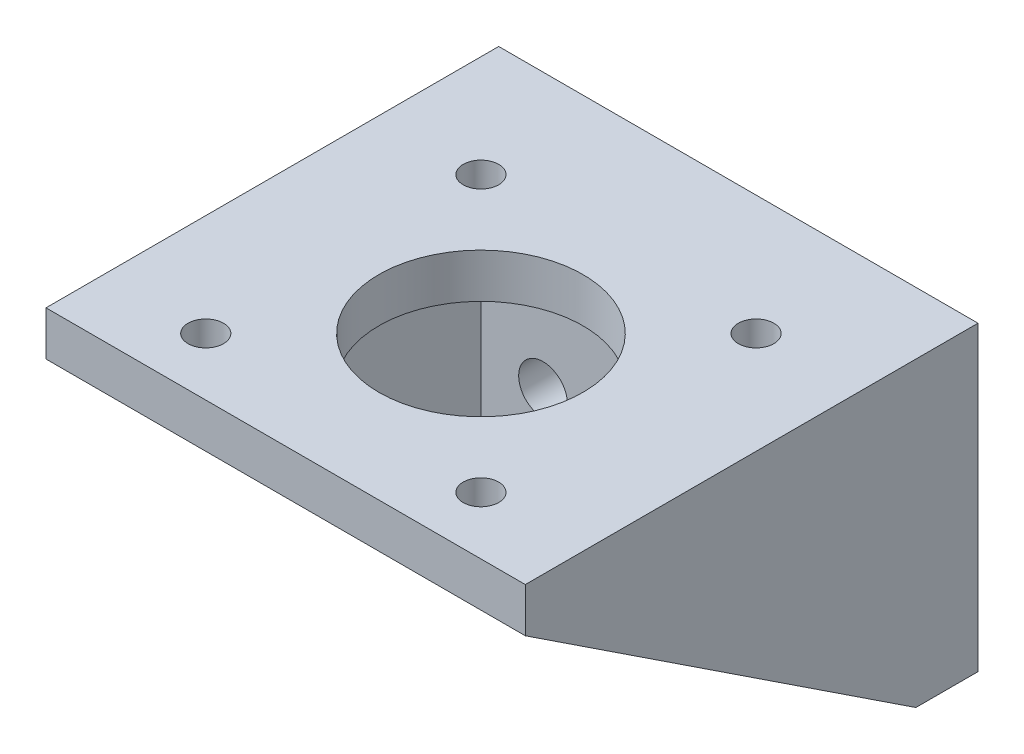
from build123d import *

# Parameters (mm, degrees)
SKETCH2_W           = 44
SKETCH2_H           = 44
SKETCH2_R           = 2
SKETCH2_R_2         = 11.5
BOSS_EXTRUDE1_DEPTH = 5
SKETCH4_W           = 44
SKETCH4_H           = 34
SKETCH4_R           = 2.75
BOSS_EXTRUDE2_DEPTH = 7
BOSS_EXTRUDE3_DEPTH = 5
BOSS_EXTRUDE4_DEPTH = 5


with BuildPart() as part:
    # Sketch2 → Boss-Extrude1 (new body)
    with BuildSketch(Plane(origin=(0, 0, 0), x_dir=(1, 0, 0), z_dir=(0, 1, 0))):
        with Locations((22, 22)):
            Rectangle(SKETCH2_W, SKETCH2_H)
        with Locations((6.5, 37.5)):
            Circle(SKETCH2_R, mode=Mode.SUBTRACT)
        with Locations((6.5, 6.5)):
            Circle(SKETCH2_R, mode=Mode.SUBTRACT)
        with Locations((37.5, 6.5)):
            Circle(SKETCH2_R, mode=Mode.SUBTRACT)
        with Locations((37.5, 37.5)):
            Circle(SKETCH2_R, mode=Mode.SUBTRACT)
        with Locations((22, 22)):
            Circle(SKETCH2_R_2, mode=Mode.SUBTRACT)
    extrude(amount=BOSS_EXTRUDE1_DEPTH)

    # Sketch4 → Boss-Extrude2 (add)
    with BuildSketch(Plane(origin=(0, 0, -44), x_dir=(-1, 0, 0), z_dir=(0, 0, -1))):
        with Locations((-22, -12)):
            Rectangle(SKETCH4_W, SKETCH4_H)
        with Locations((-37, -19)):
            Circle(SKETCH4_R, mode=Mode.SUBTRACT)
        with Locations((-7, -19)):
            Circle(SKETCH4_R, mode=Mode.SUBTRACT)
    extrude(amount=BOSS_EXTRUDE2_DEPTH)

    # Sketch5 → Boss-Extrude3 (add)
    with BuildSketch(Plane(origin=(44, 0, 0), x_dir=(0, 0, -1), z_dir=(1, 0, 0))):
        Polygon((0, 5), (51, 5), (51, -29), (44, -29), (0, 0), align=None)
    extrude(amount=BOSS_EXTRUDE3_DEPTH)

    # Sketch6 → Boss-Extrude4 (add)
    with BuildSketch(Plane.ZY):
        Polygon((-51, 5), (0, 5), (0, 0), (-44, -29), (-51, -29), align=None)
    extrude(amount=BOSS_EXTRUDE4_DEPTH)


solid = part.part
